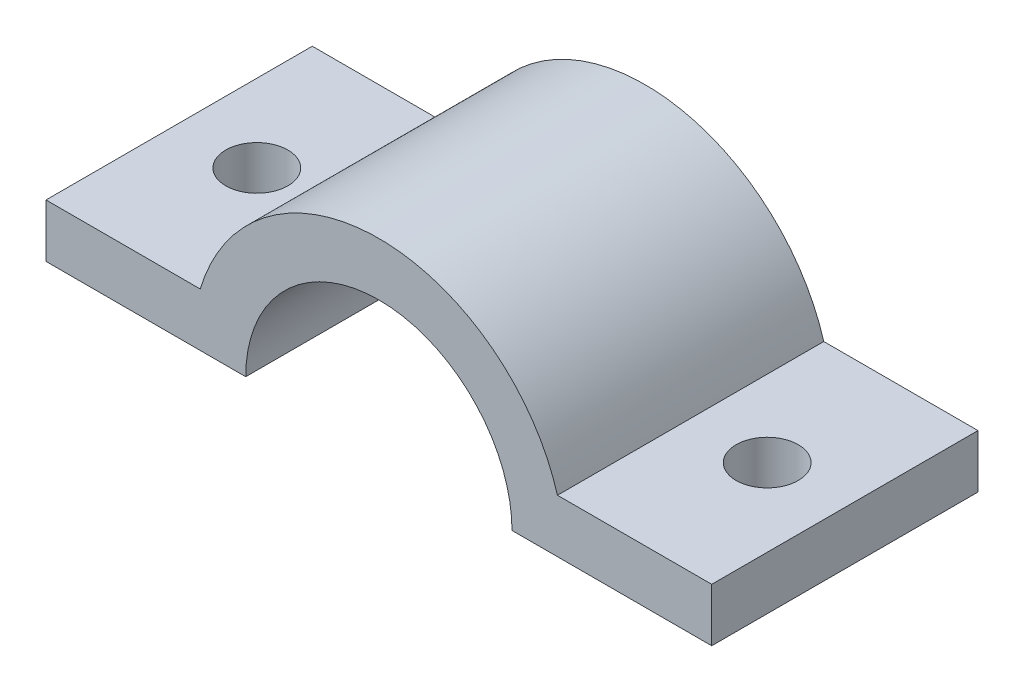
from build123d import *

# Parameters (mm, degrees)
RESSALTO_EXTRUS_O1_DEPTH   = 15
FURO_DE_DI_METRO_7_0_7_1_D = 7


with BuildPart() as part:
    # Esboço1 → Ressalto-extrusão1 (new, symmetric)
    with BuildSketch(Plane.XY):
        with BuildLine():
            Line((15, 0), (37.5, 0))
            Line((37.5, 0), (37.5, 6))
            Line((37.5, 6), (20.124611797, 6))
            ThreePointArc((20.124611797, 6), (0, 21), (-20.124611797, 6))
            Line((-20.124611797, 6), (-37.5, 6))
            Line((-37.5, 6), (-37.5, 0))
            Line((-37.5, 0), (-15, 0))
            ThreePointArc((-15, 0), (0, 15), (15, 0))
        make_face()
    extrude(amount=RESSALTO_EXTRUS_O1_DEPTH, both=True)

    # Furo de diâmetro Ø7.0 (7)1 (through all)
    with Locations(Plane(origin=(0, 6, 0), x_dir=(1, 0, 0), z_dir=(0, 1, 0))):
        with Locations((-28.75, 0), (28.75, 0)):
            Hole(FURO_DE_DI_METRO_7_0_7_1_D / 2)


solid = part.part
